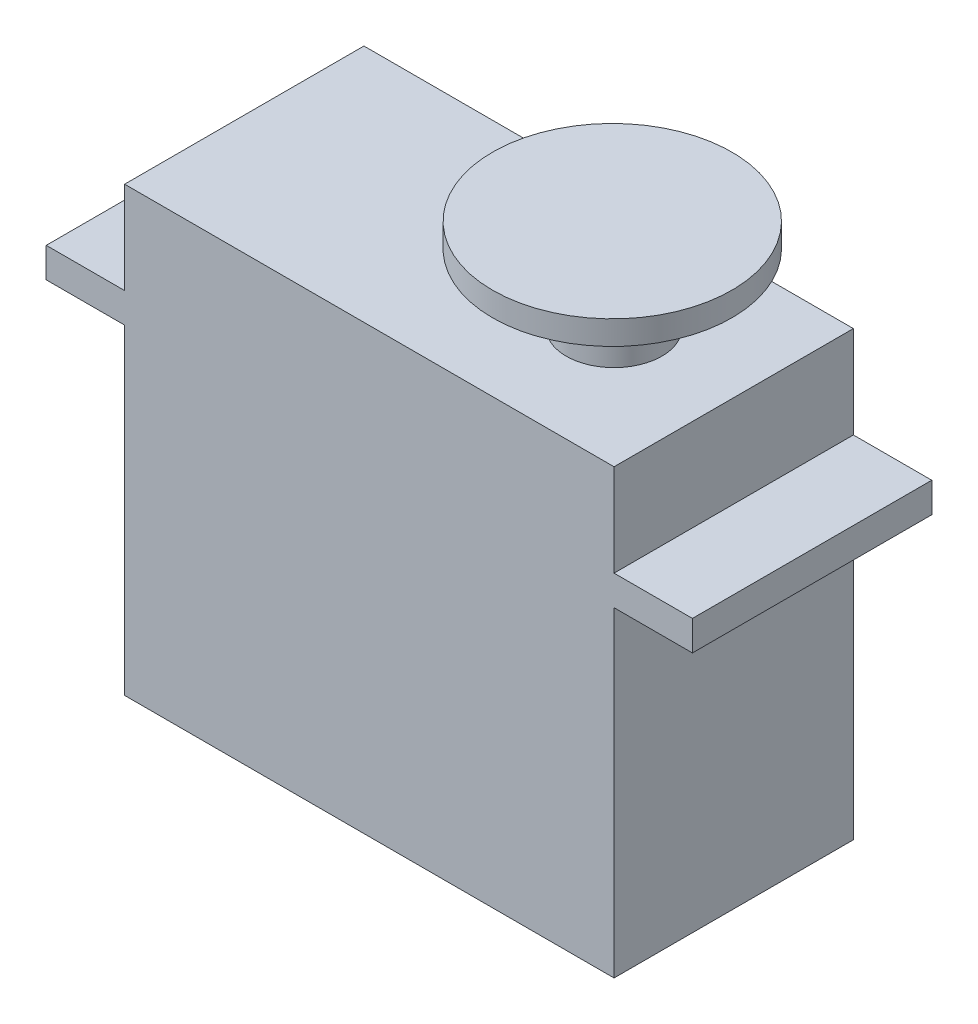
from build123d import *

# Parameters (mm, degrees)
SKETCH2_W           = 54
SKETCH2_H           = 20
BOSS_EXTRUDE1_DEPTH = 2.5
SKETCH4_W           = 40.9
SKETCH4_H           = 20
BOSS_EXTRUDE2_DEPTH = 26.8
SKETCH5_W           = 40.9
SKETCH5_H           = 20
BOSS_EXTRUDE3_DEPTH = 7.7
SKETCH6_R           = 4
BOSS_EXTRUDE4_DEPTH = 5.7
SKETCH7_R           = 10
BOSS_EXTRUDE5_DEPTH = 2


with BuildPart() as part:
    # Sketch2 → Boss-Extrude1 (new body)
    with BuildSketch(Plane(origin=(0, 0, 0), x_dir=(1, 0, 0), z_dir=(0, 1, 0))):
        Rectangle(SKETCH2_W, SKETCH2_H)
    extrude(amount=BOSS_EXTRUDE1_DEPTH)

    # Sketch4 → Boss-Extrude2 (add)
    with BuildSketch(Plane.XZ):
        Rectangle(SKETCH4_W, SKETCH4_H)
    extrude(amount=BOSS_EXTRUDE2_DEPTH)

    # Sketch5 → Boss-Extrude3 (add)
    with BuildSketch(Plane(origin=(0, 2.5, 0), x_dir=(1, 0, 0), z_dir=(0, 1, 0))):
        Rectangle(SKETCH5_W, SKETCH5_H)
    extrude(amount=BOSS_EXTRUDE3_DEPTH)

    # Sketch6 → Boss-Extrude4 (add)
    with BuildSketch(Plane(origin=(0, 10.2, 0), x_dir=(1, 0, 0), z_dir=(0, 1, 0))):
        with Locations((10.45, 0)):
            Circle(SKETCH6_R)
    extrude(amount=BOSS_EXTRUDE4_DEPTH)

    # Sketch7 → Boss-Extrude5 (add)
    with BuildSketch(Plane(origin=(0, 15.9, 0), x_dir=(1, 0, 0), z_dir=(0, 1, 0))):
        with Locations((10.301103248, 0)):
            Circle(SKETCH7_R)
    extrude(amount=BOSS_EXTRUDE5_DEPTH)


solid = part.part
